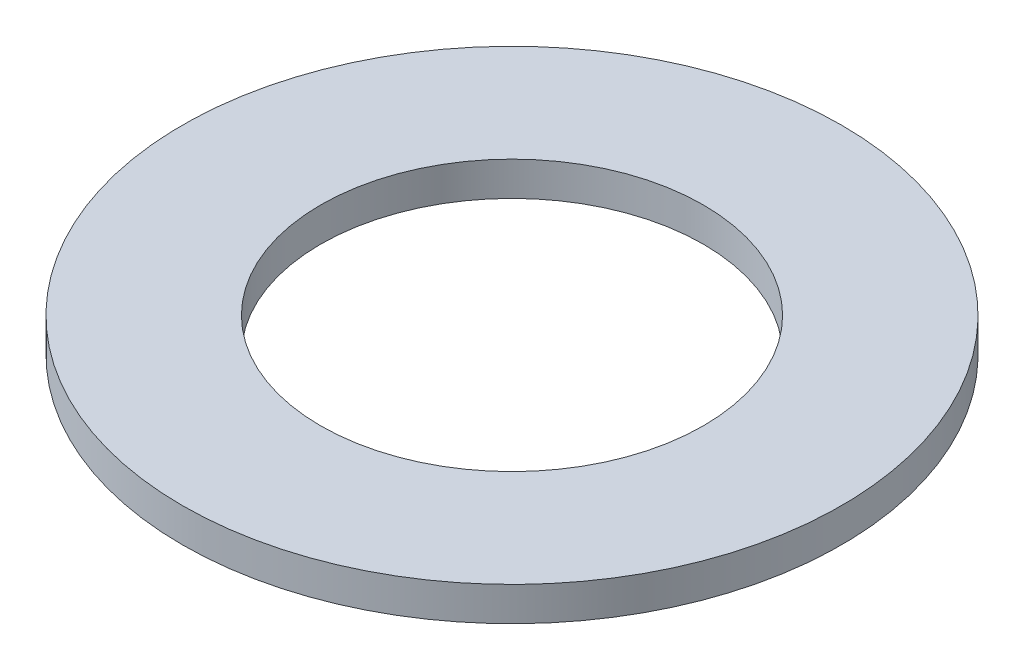
from build123d import *

# Parameters (mm, degrees)
SKETCH1_R           = 77.5
BOSS_EXTRUDE1_DEPTH = 8
SKETCH2_R           = 45
CUT_EXTRUDE1_DEPTH  = 110.893129904


with BuildPart() as part:
    # Sketch1 → Boss-Extrude1 (new body)
    with BuildSketch(Plane(origin=(0, 0, 0), x_dir=(1, 0, 0), z_dir=(0, 1, 0))):
        Circle(SKETCH1_R)
    extrude(amount=BOSS_EXTRUDE1_DEPTH)

    # Sketch2 → Cut-Extrude1 (cut, through all)
    with BuildSketch(Plane(origin=(0, 0, 0), x_dir=(1, 0, 0), z_dir=(0, 1, 0))):
        Circle(SKETCH2_R)
    extrude(amount=CUT_EXTRUDE1_DEPTH, mode=Mode.SUBTRACT)


solid = part.part
